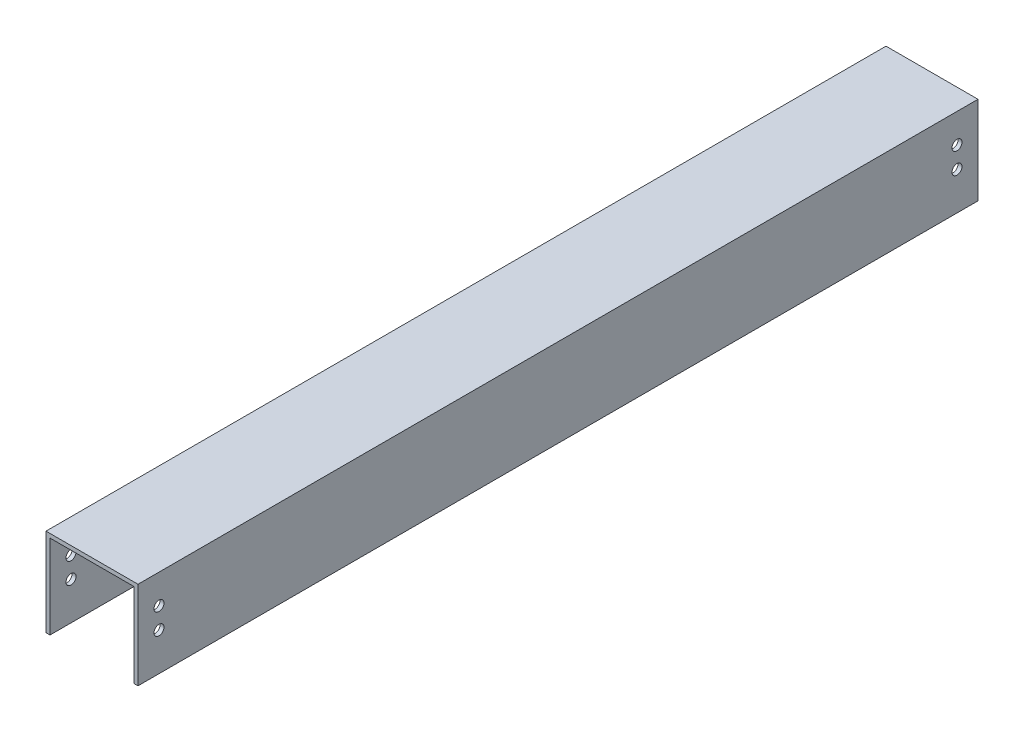
from build123d import *

# Parameters (mm, degrees)
SALIENTE_EXTRUIR1_DEPTH            = 500
TALADRO_DE_MARGEN_PARA_7_161_D     = 11.90498
TALADRO_DE_MARGEN_PARA_7_161_DEPTH = 151.5
TALADRO_DE_MARGEN_PARA_7_161_TIP   = 3.576616826
SALIENTE_EXTRUIR2_REACH            = 523.532
CROQUIS4_R                         = 11.90625


with BuildPart() as part:
    # Croquis1 → Saliente-Extruir1 (new, symmetric)
    with BuildSketch(Plane.XY):
        Polygon((0, 0), (50, 0), (50, -100), (54.7625, -100), (54.7625, 4.7625), (0, 4.7625), (-54.7625, 4.7625), (-54.7625, -100), (-50, -100), (-50, 0), align=None)
    extrude(amount=SALIENTE_EXTRUIR1_DEPTH, both=True)

    # Taladro de margen para 7/161
    with Locations(Plane(origin=(-54.7625, -829.74117116, 122.588288397), x_dir=(0, 0, 1), z_dir=(-1, 0, 0))):
        with Locations((-597.588288397, 774.74117116), (-597.588288397, 799.74117116), (352.411711603, 799.74117116), (352.411711603, 774.74117116)):
            Hole(TALADRO_DE_MARGEN_PARA_7_161_D / 2, depth=TALADRO_DE_MARGEN_PARA_7_161_DEPTH)
            with Locations((0, 0, -(TALADRO_DE_MARGEN_PARA_7_161_DEPTH + TALADRO_DE_MARGEN_PARA_7_161_TIP / 2))):  # 118° drill point
                Cone(0, TALADRO_DE_MARGEN_PARA_7_161_D / 2, TALADRO_DE_MARGEN_PARA_7_161_TIP, mode=Mode.SUBTRACT)

    # Croquis4 → Saliente-Extruir2 (add, up to next)
    with BuildSketch(Plane(origin=(54.7625, 0, 0), x_dir=(0, 0, -1), z_dir=(1, 0, 0)), mode=Mode.PRIVATE) as saliente_extruir2_sk1:
        with Locations((0, -65)):
            Circle(CROQUIS4_R)
    saliente_extruir2_tool1 = extrude(saliente_extruir2_sk1.sketch, amount=-SALIENTE_EXTRUIR2_REACH, mode=Mode.PRIVATE) - part.part
    add(saliente_extruir2_tool1.solids().sort_by_distance((54.7625, -65, 0))[0])


solid = part.part
